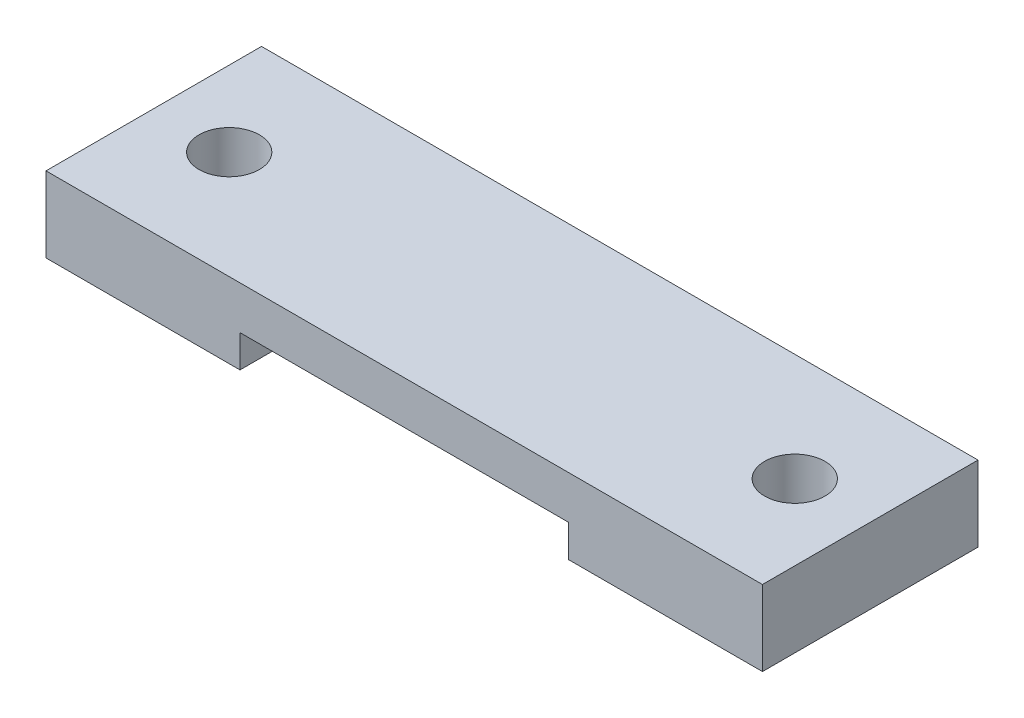
from build123d import *

# Parameters (mm, degrees)
SKETCH1_W             = 9
SKETCH1_H             = 10
SKETCH1_R             = 1.4
BOSS_EXTRUDE1_DEPTH   = 3.5
BOSS_EXTRUDE1_2_DEPTH = 3.5
SKETCH1_3_W           = 15.24
SKETCH1_3_H           = 10
BOSS_EXTRUDE2_DEPTH   = 2


with BuildPart() as part:
    # Sketch1 → Boss-Extrude1 (new body)
    with BuildSketch(Plane(origin=(0, 0, 0), x_dir=(1, 0, 0), z_dir=(0, 1, 0))):
        with Locations((-12.12, 0)):
            Rectangle(SKETCH1_W, SKETCH1_H)
        with Locations((-13.12, 0)):
            Circle(SKETCH1_R, mode=Mode.SUBTRACT)
    extrude(amount=-BOSS_EXTRUDE1_DEPTH)



with BuildPart() as body_2:
    # Sketch1 → Boss-Extrude1 2 (new body)
    with BuildSketch(Plane(origin=(0, 0, 0), x_dir=(1, 0, 0), z_dir=(0, 1, 0))):
        with Locations((12.12, 0)):
            Rectangle(SKETCH1_W, SKETCH1_H)
        with Locations((13.12, 0)):
            Circle(SKETCH1_R, mode=Mode.SUBTRACT)
    extrude(amount=-BOSS_EXTRUDE1_2_DEPTH)


with BuildPart() as part_1:
    add(part.part)

    add(body_2.part)  # Boss-Extrude2 merges body 2
    # Sketch1<3> → Boss-Extrude2 (add)
    with BuildSketch(Plane(origin=(0, 0, 0), x_dir=(1, 0, 0), z_dir=(0, 1, 0))):
        Rectangle(SKETCH1_3_W, SKETCH1_3_H)
    extrude(amount=-BOSS_EXTRUDE2_DEPTH)


solid = part_1.part
